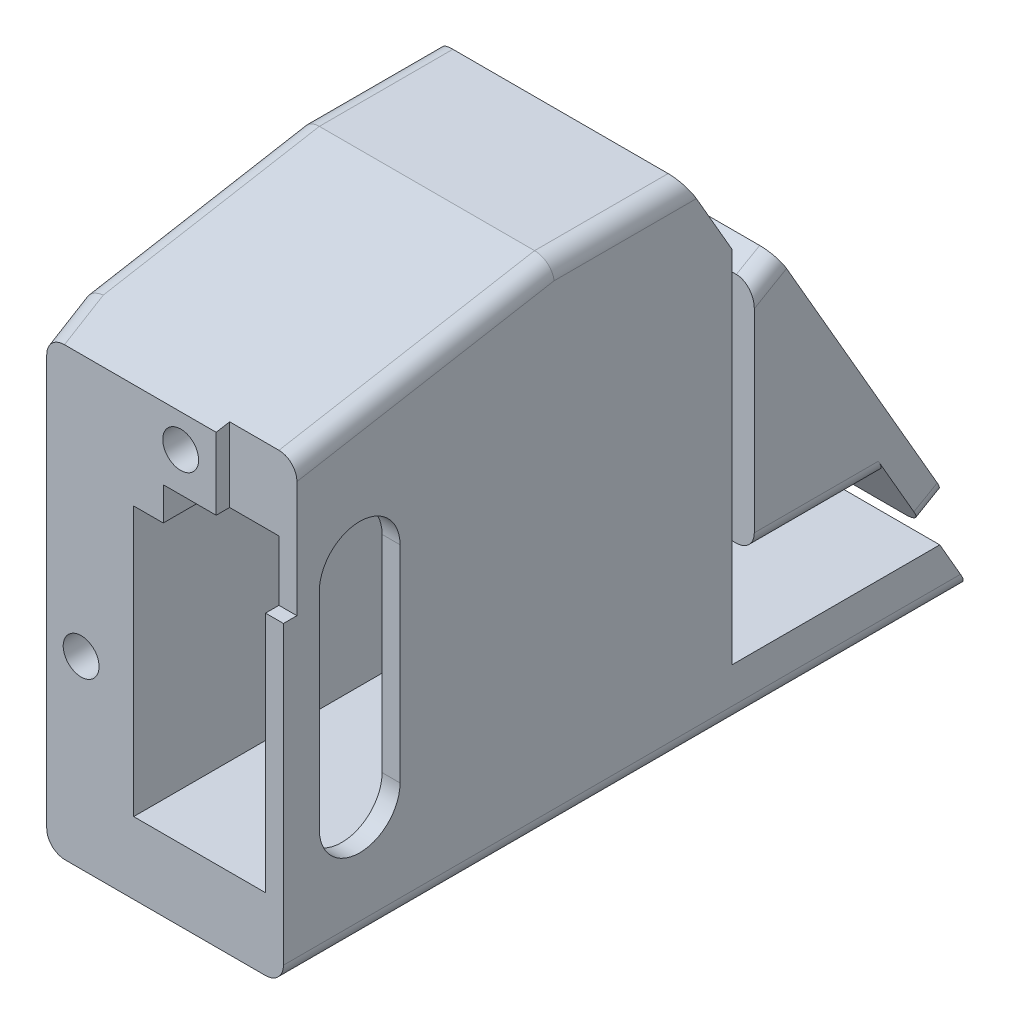
from build123d import *

# Parameters (mm, degrees)
CORPS_DEPTH                           = 9
CORPS_DEPTH_BACK                      = 19
ESQUISSE3_W                           = 14.7
ESQUISSE3_H                           = 33.7
CAVITE_BATTERIE_DEPTH                 = 85.650567232
DIAM_TRE_DU_PER_AGE_4_0_4_1_D         = 4
DIAM_TRE_DU_PER_AGE_4_0_4_1_DEPTH     = 6.7
DIAM_TRE_DU_PER_AGE_4_0_4_2_D         = 4
DIAM_TRE_DU_PER_AGE_4_0_4_2_DEPTH     = 6.7
ESQUISSE8_W                           = 26.645081595
ESQUISSE8_H                           = 40.150635095
DEGAGEMENT_TRAPPE_ET_CONNECTEUR_DEPTH = 85.164176065
CHANFREIN1_SIZE                       = 2
ESQUISSE9_W                           = 3.3
ESQUISSE9_H                           = 3.7
DETROMPEUR_BATTERIE_DEPTH             = 7
CHANFREIN2_SIZE                       = 30
CHANFREIN2_SIZE2                      = 5.289809421
CHANFREIN3_SIZE                       = 6
CHANFREIN3_SIZE2                      = 1.607695155
ESQUISSE10_W                          = 7.5
ESQUISSE10_H                          = 20
DEGAGEMENT_PIN_INTERRUPTEUR_DEPTH     = 1.5
CONG_2_R                              = 2
ESQUISSE11_W                          = 37.595854812
ESQUISSE11_H                          = 27.5
CORPS_BUTEE_1_DEPTH                   = 3
CORPS_BUTEE_2_START                   = 0.5
CORPS_BUTEE_2_DEPTH                   = 15.7
ACCROCHE_TRAPPE_DEPTH                 = 6
TROU_DE_SERRURE_DEPTH                 = 73.229072398
CONG_1_R                              = 2


with BuildPart() as part:
    # Esquisse2 → corps (new, two sides: drawn at the far end of the back side and taken through both)
    with BuildSketch(Plane(origin=(0, 0, 0), x_dir=(0, 0, -1), z_dir=(1, 0, 0)).offset(-CORPS_DEPTH_BACK)):
        Polygon((0, -24.5), (0, 30.5), (44.89081679, 30.5), (76.645081595, -24.5), align=None)
    extrude(amount=CORPS_DEPTH + CORPS_DEPTH_BACK)

    # Esquisse3 → cavite_batterie (cut, through all)
    with BuildSketch(Plane.XY):
        with Locations((-0.35, 0.35)):
            Rectangle(ESQUISSE3_W, ESQUISSE3_H)
    extrude(amount=-CAVITE_BATTERIE_DEPTH, mode=Mode.SUBTRACT)

    # Diamètre du perçage Ø4.0 (4)1
    with Locations(Plane.XY):
        with Locations((-2.45764, 21.549972456), (-13.55764, -3.950027544)):
            Hole(DIAM_TRE_DU_PER_AGE_4_0_4_1_D / 2, depth=DIAM_TRE_DU_PER_AGE_4_0_4_1_DEPTH)

    # Diamètre du perçage Ø4.0 (4)2
    with Locations(Plane(origin=(0, 27.063293868, -46.875), x_dir=(-1, 0, 0), z_dir=(0, 0.49999999999999806, -0.8660254037844397))):
        with Locations((13, -26.845854812), (13, -45.845854812)):
            Hole(DIAM_TRE_DU_PER_AGE_4_0_4_2_D / 2, depth=DIAM_TRE_DU_PER_AGE_4_0_4_2_DEPTH)

    # Esquisse8 → degagement_trappe et connecteur (cut, through all)
    with BuildSketch(Plane(origin=(-7.7, 0, 0), x_dir=(0, 0, -1), z_dir=(1, 0, 0))):
        with Locations((63.322540798, 1.575317548)):
            Rectangle(ESQUISSE8_W, ESQUISSE8_H)
        with BuildLine():
            Line((13, 11.599974456), (13, -11.400025544))
            ThreePointArc((13, -11.400025544), (8.5, -15.900025544), (4, -11.400025544))
            Line((4, -11.400025544), (4, 11.599974456))
            ThreePointArc((4, 11.599974456), (8.5, 16.099974456), (13, 11.599974456))
        make_face()
    extrude(amount=DEGAGEMENT_TRAPPE_ET_CONNECTEUR_DEPTH, mode=Mode.SUBTRACT)

    # Chanfrein1
    chanfrein1_edges = [part.edges().sort_by_distance(p)[0] for p in [
        (-0.35, 17.2, -50),
        (-0.35, -16.5, -50),
        (7, 0.35, -50),
    ]]
    chamfer(chanfrein1_edges, length=CHANFREIN1_SIZE - 0.0001)  # a hair under: the kernel refuses the full size

    # Esquisse9 → detrompeur_batterie (add)
    with BuildSketch(Plane.XY):
        with Locations((-6.05, 15.35)):
            Rectangle(ESQUISSE9_W, ESQUISSE9_H)
    extrude(amount=-DETROMPEUR_BATTERIE_DEPTH)

    # Chanfrein2
    chanfrein2_edges = [part.edges().sort_by_distance(p)[0] for p in [
        (-5, 30.5, 0),
    ]]
    chanfrein2_side = [part.faces().sort_by_distance(p)[0] for p in [
        (-5, 30.5, -22.445408395),
    ]]
    chamfer(chanfrein2_edges, length=CHANFREIN2_SIZE, length2=CHANFREIN2_SIZE2, reference=chanfrein2_side[0])

    # Chanfrein3
    chanfrein3_edges = [part.edges().sort_by_distance(p)[0] for p in [
        (-19, 0.355095289, 0),
    ]]
    chanfrein3_side = [part.faces().sort_by_distance(p)[0] for p in [
        (-19, -0.079128224, -31.587868667),
    ]]
    chamfer(chanfrein3_edges, length=CHANFREIN3_SIZE, length2=CHANFREIN3_SIZE2, reference=chanfrein3_side[0])

    # Esquisse10 → degagement_pin_interrupteur (cut)
    with BuildSketch(Plane.XY):
        with Locations((5.25, 20.5)):
            Rectangle(ESQUISSE10_W, ESQUISSE10_H)
    extrude(amount=-DEGAGEMENT_PIN_INTERRUPTEUR_DEPTH, mode=Mode.SUBTRACT)

    # Congé2
    cong_2_edges = [part.edges().sort_by_distance(p)[0] for p in [
        (-19, 30.5, -37.445408395),
        (9, 30.5, -37.445408395),
        (9, 27.987340525, -15.75),
        (-19, -24.5, -41.322540798),
        (-18.196152423, -24.5, -3),
        (-19, 28.384076231, -18),
        (-18.196152423, 25.739171521, -3),
        (9, -24.5, -38.322540798),
    ]]
    fillet(cong_2_edges, radius=CONG_2_R)


with BuildPart() as body_2:
    # Esquisse11 → corps_butee_1 (new body)
    with BuildSketch(Plane(origin=(0, 27.063293868, -46.875), x_dir=(0, -0.8660254037844398, -0.499999999999998), z_dir=(0, -0.49999999999999806, 0.8660254037844399))):
        with Locations((31.047927406, -5.25)):
            Rectangle(ESQUISSE11_W, ESQUISSE11_H)
    extrude(amount=-CORPS_BUTEE_1_DEPTH)

    # Esquisse12 → corps_butee_2 (add)
    with BuildSketch(Plane(origin=(-7.7, 0, 0), x_dir=(0, 0, -1), z_dir=(1, 0, 0)).offset(CORPS_BUTEE_2_START)):
        Polygon((53, 16.454482672), (53, -9.5), (67.984827557, -9.5), align=None)
    extrude(amount=CORPS_BUTEE_2_DEPTH)

    # Esquisse14 → accroche_trappe (cut, symmetric)
    with BuildSketch(Plane(origin=(0, 0, 0), x_dir=(0, 0, -1), z_dir=(1, 0, 0))):
        with BuildLine():
            Line((55.345299462, 4.392304845), (60.417096231, -4.392304845))
            ThreePointArc((60.417096231, -4.392304845), (62.24722325, -6.222431864), (64.74722325, -6.892304845))
            Line((64.74722325, -6.892304845), (69.943375673, -6.892304845))
            Line((69.943375673, -6.892304845), (64.943375673, 1.767949192))
            ThreePointArc((64.943375673, 1.767949192), (62.211324865, 2.5), (62.943375673, 5.232050808))
            Line((62.943375673, 5.232050808), (57.943375673, 13.892304845))
            Line((57.943375673, 13.892304845), (55.345299462, 9.392304845))
            ThreePointArc((55.345299462, 9.392304845), (54.675426481, 6.892304845), (55.345299462, 4.392304845))
        make_face()
    extrude(amount=ACCROCHE_TRAPPE_DEPTH, both=True, mode=Mode.SUBTRACT)

    # Esquisse13 → trou_de_serrure (cut, through all)
    with BuildSketch(Plane(origin=(0, 27.063293868, -46.875), x_dir=(0, -0.8660254037844398, -0.499999999999998), z_dir=(0, -0.49999999999999806, 0.8660254037844399))):
        with BuildLine():
            Line((45.845854812, -11.4), (41.845854812, -11.4))
            ThreePointArc((41.845854812, -11.4), (35.445854812, -13), (41.845854812, -14.6))
            Line((41.845854812, -14.6), (45.845854812, -14.6))
            ThreePointArc((45.845854812, -14.6), (47.445854812, -13), (45.845854812, -11.4))
        make_face()
        with BuildLine():
            Line((26.845854812, -11.4), (22.845854812, -11.4))
            ThreePointArc((22.845854812, -11.4), (16.445854812, -13), (22.845854812, -14.6))
            Line((22.845854812, -14.6), (26.845854812, -14.6))
            ThreePointArc((26.845854812, -14.6), (28.445854812, -13), (26.845854812, -11.4))
        make_face()
    extrude(amount=-TROU_DE_SERRURE_DEPTH, mode=Mode.SUBTRACT)

    # Congé1
    cong_1_edges = [body_2.edges().sort_by_distance(p)[0] for p in [
        (-7.2, -9.5, -60.492413779),
        (8.5, -9.5, -60.492413779),
        (-14.6, -8.426279442, -69.096965511),
        (-11.4, -8.426279442, -69.096965511),
        (-14.6, 8.02820323, -59.596965511),
        (-11.4, 8.02820323, -59.596965511),
        (-19, -15.354482672, -73.096965511),
        (-19, 17.204482672, -54.299038106),
        (8.5, 17.204482672, -54.299038106),
        (8.5, -15.354482672, -73.096965511),
    ]]
    fillet(cong_1_edges, radius=CONG_1_R)


solid = Compound([part.part, body_2.part])
